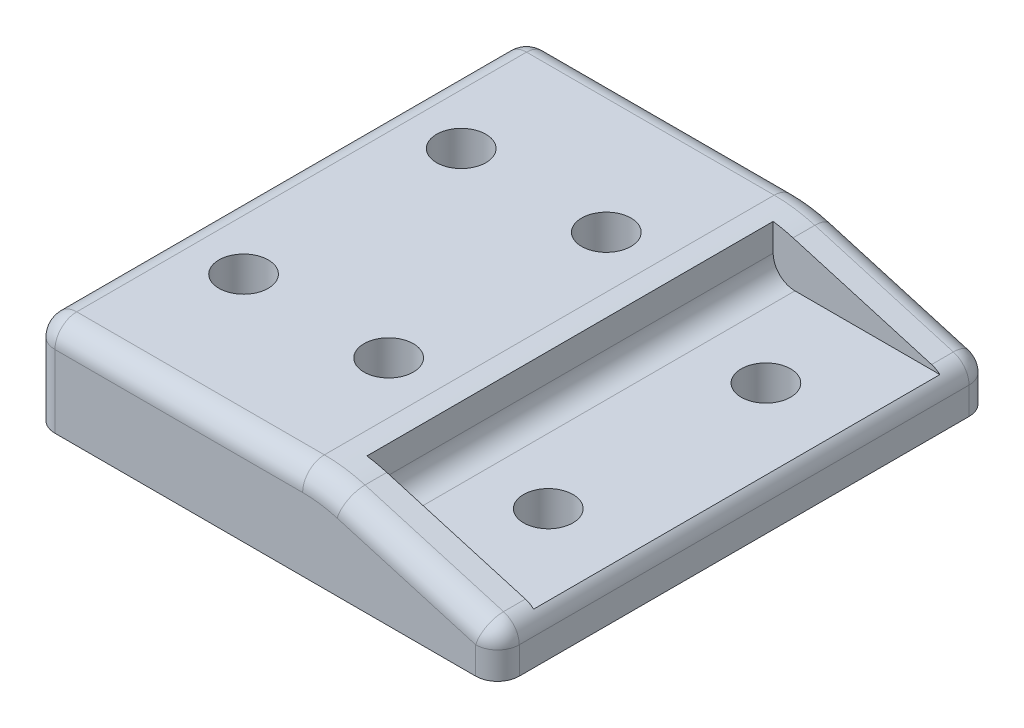
from build123d import *

# Parameters (mm, degrees)
PROFILE_EXTRUDE_DEPTH               = 34
GUSSET_1_EXTRUDE_DEPTH              = 3
GUSSET_START                        = 31
GUSSET_2_EXTRUDE_DEPTH              = 3
SOLENOID_MOUNTING_HOLES_D           = 3.4
SOLENOID_MOUNTING_HOLES_CBORE_D     = 7
SOLENOID_MOUNTING_HOLES_CBORE_DEPTH = 3.9
M3_MOUNTING_HOLES_D                 = 3.4
FRONT_START                         = -1
FRONT_EDGE_FILLETS_DEPTH            = 36
FRONT_EDGE_FILLETS_2_DEPTH          = 34
TOP_START                           = -1
TOP_EDGE_FILLET_DEPTH               = 36
CORNER_FILLETS_R                    = 1.5


with BuildPart() as part:
    # Profile Sketch → Profile  Extrude (new body)
    with BuildSketch(Plane.XY):
        Polygon((0, 0), (0, 3.5), (-20, 3.5), (-20, -3), (12, -3), (12, 0), align=None)
    extrude(amount=PROFILE_EXTRUDE_DEPTH)

    # Gusset Sketch → Gusset 1 Extrude (add)
    with BuildSketch(Plane.XY):
        Polygon((0, 0), (12, 0), (0, 3.5), align=None)
    extrude(amount=GUSSET_1_EXTRUDE_DEPTH)

    # Gusset Sketch<2> → Gusset 2 Extrude (add)
    with BuildSketch(Plane.XY.offset(GUSSET_START)):
        Polygon((0, 0), (12, 0), (0, 3.5), align=None)
    extrude(amount=GUSSET_2_EXTRUDE_DEPTH)

    # Solenoid Mounting Holes (through all)
    with Locations(Plane(origin=(-3, -3, 0), x_dir=(0, 0, -1), z_dir=(0, -1, 0))):
        with Locations((-9.5, -12), (-24.5, -12), (-24.5, -2), (-9.5, -2)):
            CounterBoreHole(SOLENOID_MOUNTING_HOLES_D / 2, SOLENOID_MOUNTING_HOLES_CBORE_D / 2, SOLENOID_MOUNTING_HOLES_CBORE_DEPTH)

    # M3 Mounting Holes (through all)
    with Locations(Plane(origin=(0, 0, 0), x_dir=(1, 0, 0), z_dir=(0, 1, 0))):
        with Locations((6, -24.5), (6, -9.5)):
            Hole(M3_MOUNTING_HOLES_D / 2)

    # Front Edge Fillets: read off the stored shape, not the designer's step
    # Front Edge Fillets outline → Front Edge Fillets (cut)
    with BuildSketch(Plane.XY.offset(FRONT_START)):
        with BuildLine():
            Line((12, -1.125), (12, 0))
            Line((12, 0), (10.92, 0.315))
            ThreePointArc((10.92, 0.315), (11.7, -0.225), (12, -1.125))
        make_face()
    extrude(amount=FRONT_EDGE_FILLETS_DEPTH, mode=Mode.SUBTRACT)

    # Front Edge Fillets 2 outline → Front Edge Fillets 2 (add)
    with BuildSketch(Plane.XY):
        with BuildLine():
            ThreePointArc((1.5, 0), (0.439339828, 0.439339828), (0, 1.5))
            Line((0, 1.5), (0, 0))
            Line((0, 0), (1.5, 0))
        make_face()
    extrude(amount=FRONT_EDGE_FILLETS_2_DEPTH)

    # Top Edge Fillet: read off the stored shape, not the designer's step
    # Top Edge Fillet outline → Top Edge Fillet (cut)
    with BuildSketch(Plane.XY.offset(TOP_START)):
        with BuildLine():
            Line((1.371428571, 3.1), (0, 3.5))
            Line((0, 3.5), (-1.428571429, 3.5))
            ThreePointArc((-1.428571429, 3.5), (-0.014357867, 3.399494937), (1.371428571, 3.1))
        make_face()
    extrude(amount=TOP_EDGE_FILLET_DEPTH, mode=Mode.SUBTRACT)

    # Corner Fillets
    corner_fillets_edges = [part.edges().sort_by_distance(p)[0] for p in [
        (-10.714285714, 3.5, 0),
        (-10.714285714, 3.5, 34),
        (-0.014357867, 3.399494937, 0),
        (-0.014357867, 3.399494937, 34),
        (-20, 3.5, 17),
        (-20, 0.25, 34),
        (12, -2.0625, 34),
        (12, -2.0625, 0),
        (-20, 0.25, 0),
        (6.145714286, 1.7075, 0),
        (11.7, -0.225, 0),
        (6.145714286, 1.7075, 34),
        (11.7, -0.225, 34),
    ]]
    fillet(corner_fillets_edges, radius=CORNER_FILLETS_R)


solid = part.part
